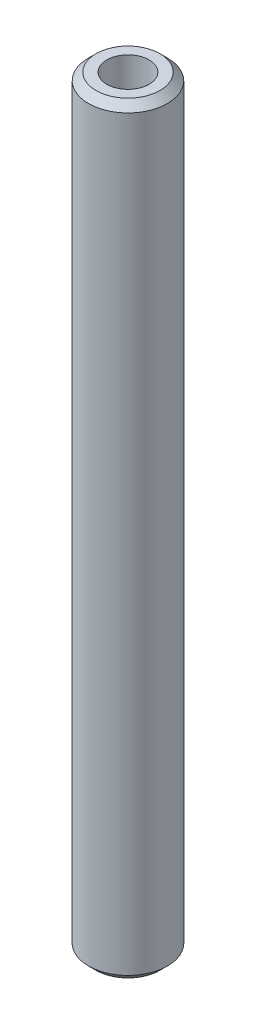
from build123d import *

# Parameters (mm, degrees)
SKETCH1_R           = 27.5
BOSS_EXTRUDE1_DEPTH = 530.901549635
SKETCH2_R           = 14.745406835
CUT_EXTRUDE1_DEPTH  = 533.324107481
CHAMFER1_SIZE       = 5.235894373


with BuildPart() as part:
    # Sketch1 → Boss-Extrude1 (new body)
    with BuildSketch(Plane(origin=(0, 0, 0), x_dir=(1, 0, 0), z_dir=(0, 1, 0))):
        Circle(SKETCH1_R)
    extrude(amount=BOSS_EXTRUDE1_DEPTH)

    # Sketch2 → Cut-Extrude1 (cut, through all)
    with BuildSketch(Plane(origin=(0, 0, 0), x_dir=(1, 0, 0), z_dir=(0, 1, 0))):
        Circle(SKETCH2_R)
    extrude(amount=CUT_EXTRUDE1_DEPTH, mode=Mode.SUBTRACT)

    # Chamfer1
    chamfer1_edges = [part.edges().sort_by_distance(p)[0] for p in [
        (-27.5, 530.901549635, 0),
        (-27.5, 0, 0),
    ]]
    chamfer(chamfer1_edges, length=CHAMFER1_SIZE)


solid = part.part
